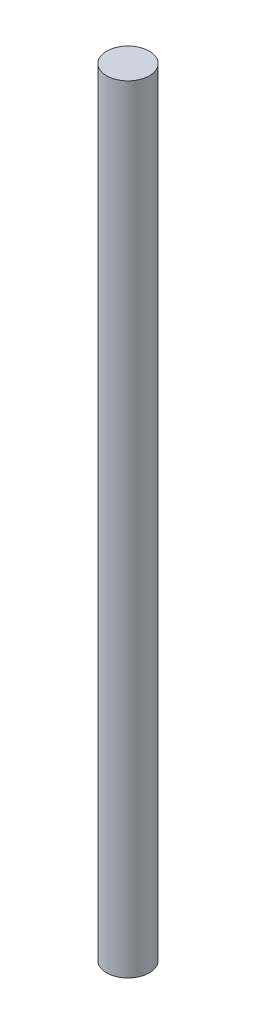
from build123d import *

# Parameters (mm, degrees)
SKETCH1_R           = 11
BOSS_EXTRUDE1_DEPTH = 400


with BuildPart() as part:
    # Sketch1 → Boss-Extrude1 (new body)
    with BuildSketch(Plane(origin=(0, 0, 0), x_dir=(1, 0, 0), z_dir=(0, 1, 0))):
        Circle(SKETCH1_R)
    extrude(amount=BOSS_EXTRUDE1_DEPTH)


solid = part.part
